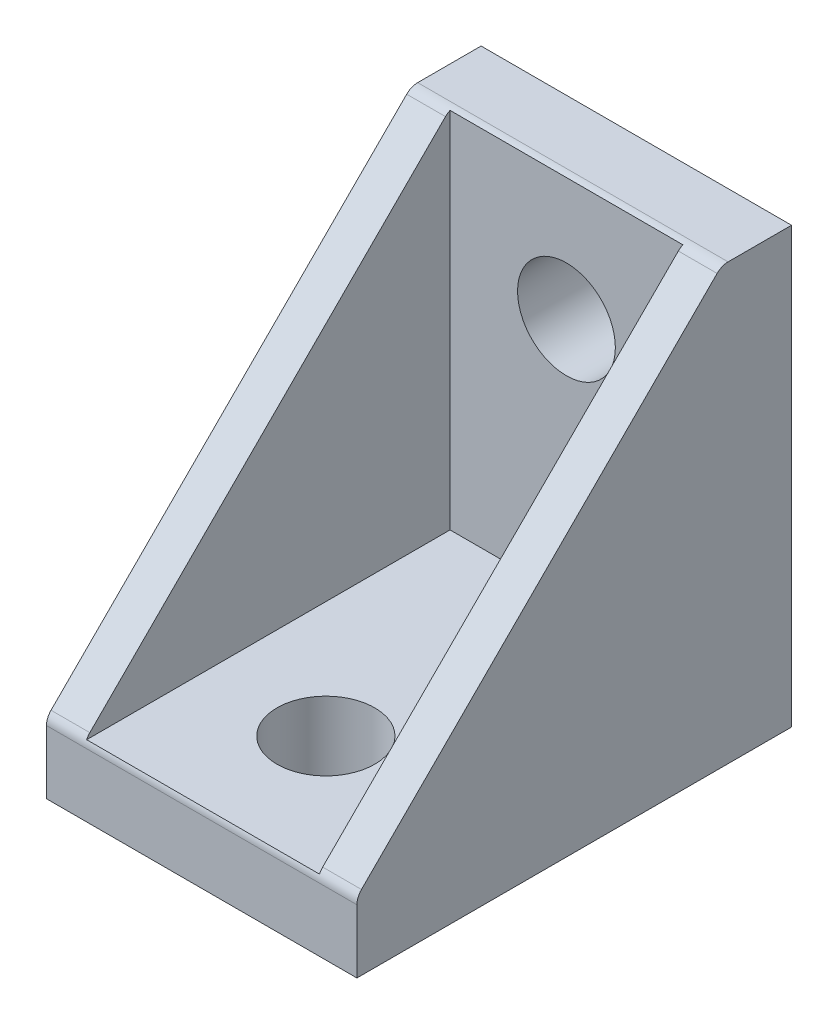
from build123d import *

# Parameters (mm, degrees)
BOSS_EXTRUDE1_DEPTH            = 20
SKETCH2_W                      = 20
SKETCH2_H                      = 23.5
BOSS_EXTRUDE2_DEPTH            = 4.5
CUT_EXTRUDE1_DEPTH             = 15
SKETCH4_W                      = 20
SKETCH4_H                      = 28
BOSS_EXTRUDE3_DEPTH            = 4.5
SKETCH5_W                      = 8
SKETCH5_H                      = 2
BOSS_EXTRUDE4_DEPTH            = 1
SKETCH6_W                      = 8
SKETCH6_H                      = 2
BOSS_EXTRUDE5_DEPTH            = 1
SKETCH7_W                      = 8
SKETCH7_H                      = 2
BOSS_EXTRUDE6_DEPTH            = 1
SKETCH8_W                      = 8
SKETCH8_H                      = 2
BOSS_EXTRUDE7_DEPTH            = 1
F_6_3_6_3_DIAMETER_HOLE1_D     = 6.3
F_6_3_6_3_DIAMETER_HOLE1_DEPTH = 28
F_6_3_6_3_DIAMETER_HOLE2_D     = 6.3
F_6_3_6_3_DIAMETER_HOLE2_DEPTH = 5.5
FILLET1_R                      = 0.3
FILLET2_START                  = -11
FILLET2_DEPTH                  = 22


with BuildPart() as part:
    # Sketch1 → Boss-Extrude1 (new body)
    with BuildSketch(Plane(origin=(-10, 0, 0), x_dir=(0, -1, 0), z_dir=(-1, 0, 0))):
        with BuildLine():
            Line((-28, 4.5), (-4.5, 4.5))
            Line((-4.5, 4.5), (-4.5, 28))
            Line((-4.5, 28), (-4.792893219, 27.707106781))
            add(Edge.make_bspline(
                [(-4.792893219, 27.707106781), (-12.430964406, 20.069035594), (-20.069035594, 12.430964406), (-27.707106781, 4.792893219)],
                knots=[0, 0, 0, 0, 1, 1, 1, 1], degree=3))
            Line((-27.707106781, 4.792893219), (-28, 4.5))
        make_face()
    extrude(amount=-BOSS_EXTRUDE1_DEPTH)

    # Sketch2 → Boss-Extrude2 (add)
    with BuildSketch(Plane.XZ.offset(-4.5)):
        with Locations((0, 16.25)):
            Rectangle(SKETCH2_W, SKETCH2_H)
    extrude(amount=BOSS_EXTRUDE2_DEPTH)

    # Sketch3 → Cut-Extrude1 (cut)
    with BuildSketch(Plane(origin=(-7.5, 0, 0), x_dir=(0, -1, 0), z_dir=(-1, 0, 0))):
        with BuildLine():
            Line((-4.5, 4.5), (-4.5, 28))
            Line((-4.5, 28), (-4.792893219, 27.707106781))
            add(Edge.make_bspline(
                [(-4.792893219, 27.707106781), (-12.430964406, 20.069035594), (-20.069035594, 12.430964406), (-27.707106781, 4.792893219)],
                knots=[0, 0, 0, 0, 1, 1, 1, 1], degree=3))
            Line((-27.707106781, 4.792893219), (-28, 4.5))
            Line((-28, 4.5), (-4.5, 4.5))
        make_face()
    extrude(amount=-CUT_EXTRUDE1_DEPTH, mode=Mode.SUBTRACT)

    # Sketch4 → Boss-Extrude3 (add)
    with BuildSketch(Plane(origin=(0, 0, 4.5), x_dir=(-1, 0, 0), z_dir=(0, 0, -1))):
        with Locations((0, 14)):
            Rectangle(SKETCH4_W, SKETCH4_H)
    extrude(amount=BOSS_EXTRUDE3_DEPTH)

    # Sketch5 → Boss-Extrude4 (add)
    with BuildSketch(Plane.XZ):
        with Locations((0, 24.5)):
            Rectangle(SKETCH5_W, SKETCH5_H)
    extrude(amount=BOSS_EXTRUDE4_DEPTH)

    # Sketch6 → Boss-Extrude5 (add)
    with BuildSketch(Plane.XZ):
        with Locations((0, 5)):
            Rectangle(SKETCH6_W, SKETCH6_H)
    extrude(amount=BOSS_EXTRUDE5_DEPTH)

    # Sketch7 → Boss-Extrude6 (add)
    with BuildSketch(Plane(origin=(0, 0, 0), x_dir=(-1, 0, 0), z_dir=(0, 0, -1))):
        with Locations((0, 5)):
            Rectangle(SKETCH7_W, SKETCH7_H)
    extrude(amount=BOSS_EXTRUDE6_DEPTH)

    # Sketch8 → Boss-Extrude7 (add)
    with BuildSketch(Plane(origin=(0, 0, 0), x_dir=(-1, 0, 0), z_dir=(0, 0, -1))):
        with Locations((0, 24.5)):
            Rectangle(SKETCH8_W, SKETCH8_H)
    extrude(amount=BOSS_EXTRUDE7_DEPTH)

    # Ø6.3 (6.3) Diameter Hole1
    with Locations(Plane(origin=(0, 0, 0), x_dir=(-1, 0, 0), z_dir=(0, 0, -1))):
        with Locations((0, 20)):
            Hole(F_6_3_6_3_DIAMETER_HOLE1_D / 2, depth=F_6_3_6_3_DIAMETER_HOLE1_DEPTH)

    # Ø6.3 (6.3) Diameter Hole2
    with Locations(Plane(origin=(0, 4.5, 0), x_dir=(1, 0, 0), z_dir=(0, 1, 0))):
        with Locations((0, -20)):
            Hole(F_6_3_6_3_DIAMETER_HOLE2_D / 2, depth=F_6_3_6_3_DIAMETER_HOLE2_DEPTH)

    # Fillet1
    fillet1_edges = [part.edges().sort_by_distance(p)[0] for p in [
        (-4, 23.5, -0.5),
        (-4, 25.5, -0.5),
        (4, 25.5, -0.5),
        (4, 23.5, -0.5),
        (4, -0.5, 25.5),
        (-4, -0.5, 25.5),
        (-4, -0.5, 23.5),
        (4, -0.5, 23.5),
        (4, -0.5, 6),
        (-4, -0.5, 6),
        (-4, -0.5, 4),
        (4, -0.5, 4),
        (-4, 4, -0.5),
        (-4, 6, -0.5),
        (4, 6, -0.5),
        (4, 4, -0.5),
    ]]
    fillet(fillet1_edges, radius=FILLET1_R)

    # Fillet2: read off the stored shape, not the designer's step
    # Fillet2 outline → Fillet2 (cut)
    with BuildSketch(Plane.YZ.offset(FILLET2_START)):
        with BuildLine():
            Line((28, 4.085786438), (28, 4.5))
            Line((28, 4.5), (27.707106781, 4.792893219))
            ThreePointArc((27.707106781, 4.792893219), (27.923879533, 4.46846987), (28, 4.085786438))
        make_face()
        with BuildLine():
            Line((4.792893219, 27.707106781), (4.5, 28))
            Line((4.5, 28), (4.085786438, 28))
            ThreePointArc((4.085786438, 28), (4.46846987, 27.923879533), (4.792893219, 27.707106781))
        make_face()
    extrude(amount=FILLET2_DEPTH, mode=Mode.SUBTRACT)


solid = part.part
